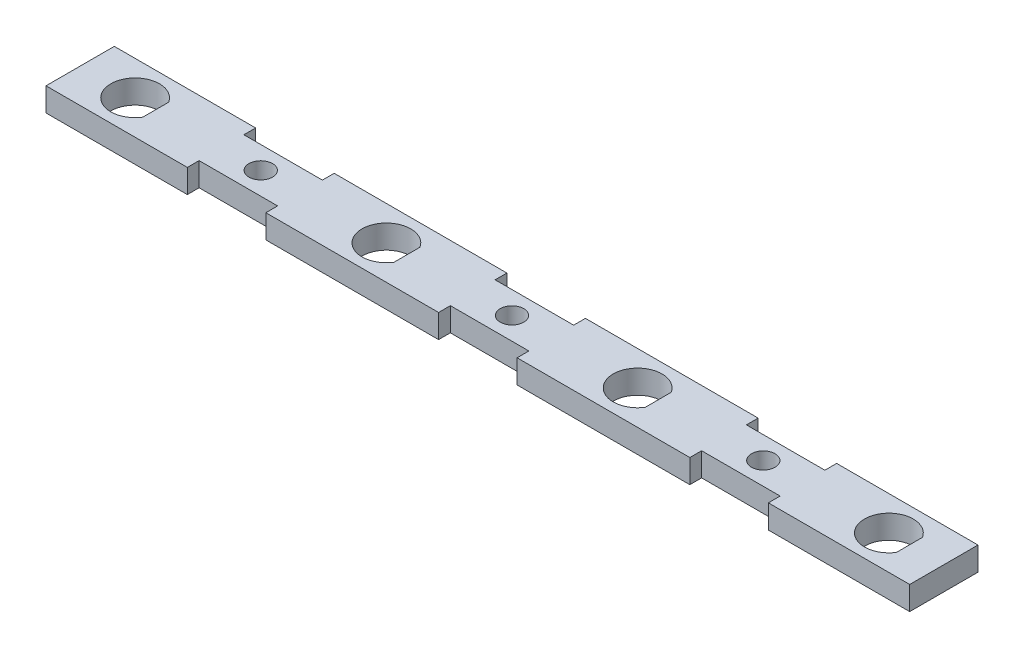
from build123d import *

# Parameters (mm, degrees)
SKETCH2_W           = 110
SKETCH2_H           = 8.7
BOSS_EXTRUDE1_DEPTH = 3
SKETCH3_R           = 1.5
SKETCH3_W           = 10
SKETCH3_H           = 1.5
CUT_EXTRUDE1_DEPTH  = 56.253257823


with BuildPart() as part:
    # Sketch2 → Boss-Extrude1 (new body)
    with BuildSketch(Plane(origin=(0, 0, 0), x_dir=(1, 0, 0), z_dir=(0, 1, 0))):
        Rectangle(SKETCH2_W, SKETCH2_H)
        with BuildLine():
            Line((50.621254471, 1.655), (50.621254471, -1.655))
            ThreePointArc((50.621254471, -1.655), (44.9, 0), (50.621254471, 1.655))
        make_face(mode=Mode.SUBTRACT)
        with BuildLine():
            Line((18.621254471, 1.655), (18.621254471, -1.655))
            ThreePointArc((18.621254471, -1.655), (12.9, 0), (18.621254471, 1.655))
        make_face(mode=Mode.SUBTRACT)
        with BuildLine():
            Line((-13.378745529, 1.655), (-13.378745529, -1.655))
            ThreePointArc((-13.378745529, -1.655), (-19.1, 0), (-13.378745529, 1.655))
        make_face(mode=Mode.SUBTRACT)
        with BuildLine():
            Line((-45.378745529, 1.655), (-45.378745529, -1.655))
            ThreePointArc((-45.378745529, -1.655), (-51.1, 0), (-45.378745529, 1.655))
        make_face(mode=Mode.SUBTRACT)
    extrude(amount=BOSS_EXTRUDE1_DEPTH)

    # Sketch3 → Cut-Extrude1 (cut, through all)
    with BuildSketch(Plane(origin=(0, 3, 0), x_dir=(1, 0, 0), z_dir=(0, 1, 0))):
        Circle(SKETCH3_R)
        with Locations((32, 0)):
            Circle(SKETCH3_R)
        with Locations((-32, 0)):
            Circle(SKETCH3_R)
        with Locations((-32, 3.6)):
            Rectangle(SKETCH3_W, SKETCH3_H)
        with Locations((0, 3.6)):
            Rectangle(SKETCH3_W, SKETCH3_H)
        with Locations((32, 3.6)):
            Rectangle(SKETCH3_W, SKETCH3_H)
        with Locations((-32, -3.6)):
            Rectangle(SKETCH3_W, SKETCH3_H)
        with Locations((0, -3.6)):
            Rectangle(SKETCH3_W, SKETCH3_H)
        with Locations((32, -3.6)):
            Rectangle(SKETCH3_W, SKETCH3_H)
    extrude(amount=-CUT_EXTRUDE1_DEPTH, mode=Mode.SUBTRACT)


solid = part.part
